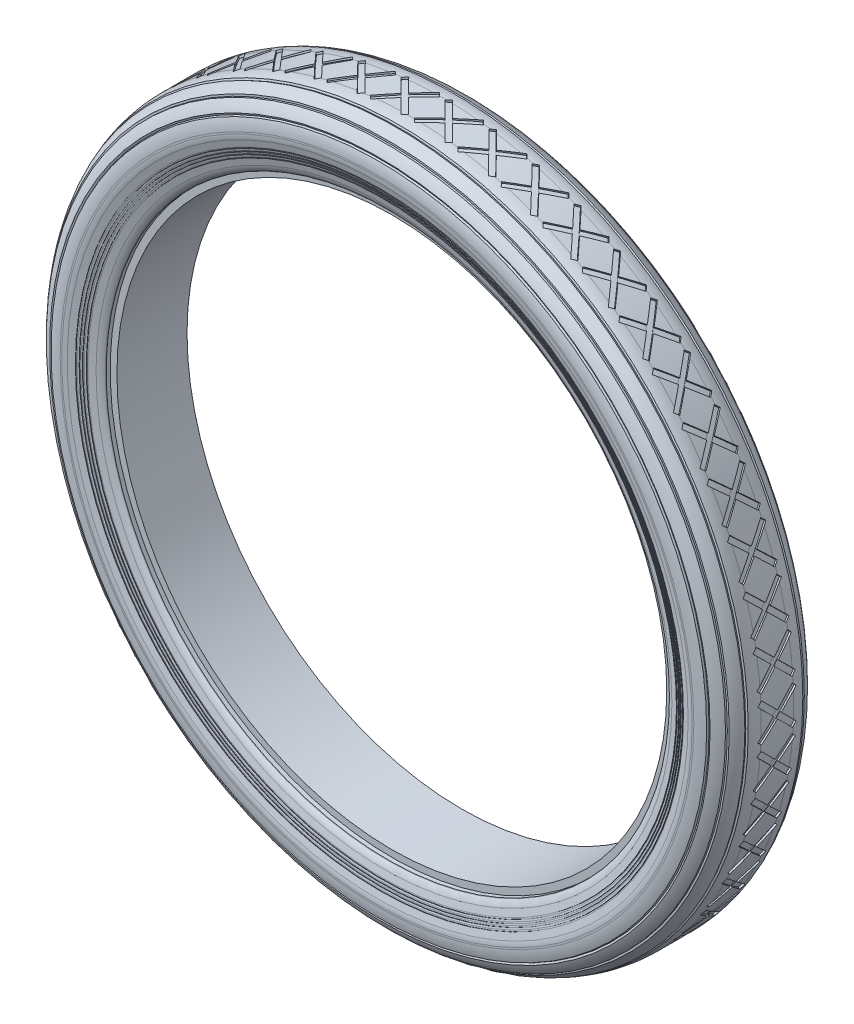
from build123d import *

# Parameters (mm, degrees)
CUT_REVOLVE_2_ANGLE      = 8
CUT_REVOLVE_3_ANGLE      = 8
PATTERN_CIRCULAR_6_COUNT = 50


with BuildPart() as part:
    # Эскиз2 → Повернуть1 (revolve)
    with BuildSketch(Plane(origin=(0, 0, 0), x_dir=(0, 0, -1), z_dir=(1, 0, 0))):
        with BuildLine():
            Line((-10.418793701, 260), (10.418793701, 260))
            Line((10.418793701, 260), (12, 260))
            ThreePointArc((12, 260), (16.178502184, 259.648328939), (20.239447704, 258.60320956))
            Line((20.239447704, 258.60320956), (20.792701047, 257.331332435))
            Line((20.792701047, 257.331332435), (22.064578172, 257.884585778))
            ThreePointArc((22.064578172, 257.884585778), (25.747933003, 255.880477441), (29.044507819, 253.288924332))
            Line((29.044507819, 253.288924332), (29.044507819, 251.90364999))
            Line((29.044507819, 251.90364999), (30.419191541, 251.90364999))
            ThreePointArc((30.419191541, 251.90364999), (32.959261901, 248.627521439), (34.92303721, 244.976691088))
            Line((34.92303721, 244.976691088), (34.364907479, 243.706946276))
            Line((34.364907479, 243.706946276), (35.634652291, 243.148816545))
            ThreePointArc((35.634652291, 243.148816545), (36.656300486, 239.131203985), (37, 235))
            Line((37, 235), (37, 233.788438789))
            ThreePointArc((37, 233.788438789), (36.878699379, 232.016687595), (36.517061185, 230.278000173))
            Line((36.517061185, 230.278000173), (35.193049841, 225.55701433))
            Line((35.193049841, 225.55701433), (34.711624411, 225.6920312))
            Line((34.711624411, 225.6920312), (34.441590671, 224.72918034))
            Line((34.441590671, 224.72918034), (34.923016101, 224.59416347))
            Line((34.923016101, 224.59416347), (34.577617008, 223.362584725))
            Line((34.577617008, 223.362584725), (34.096741575, 223.497447347))
            Line((34.096741575, 223.497447347), (33.826707835, 222.534596486))
            Line((33.826707835, 222.534596486), (34.307583268, 222.399733865))
            Line((34.307583268, 222.399733865), (34.037549528, 221.436883004))
            Line((34.037549528, 221.436883004), (33.556674096, 221.571745626))
            Line((33.556674096, 221.571745626), (33.286640356, 220.608894765))
            Line((33.286640356, 220.608894765), (33.767515788, 220.474032144))
            Line((33.767515788, 220.474032144), (33.422116695, 219.242453399))
            Line((33.422116695, 219.242453399), (32.940691265, 219.377470269))
            Line((32.940691265, 219.377470269), (32.670657525, 218.414619408))
            Line((32.670657525, 218.414619408), (33.152082955, 218.279602538))
            Line((33.152082955, 218.279602538), (31.828071611, 213.558616696))
            ThreePointArc((31.828071611, 213.558616696), (30.830599109, 211.20868521), (29.270630818, 209.187886281))
            Line((29.270630818, 209.187886281), (29, 208.917255463))
            Line((29, 208.917255463), (26, 208.917255463))
            Line((26, 208.917255463), (26, 203.917255463))
            Line((26, 203.917255463), (-26, 203.917255463))
            Line((-26, 203.917255463), (-26, 208.917255463))
            Line((-26, 208.917255463), (-29, 208.917255463))
            Line((-29, 208.917255463), (-29.270630818, 209.187886281))
            ThreePointArc((-29.270630818, 209.187886281), (-30.830599109, 211.20868521), (-31.828071611, 213.558616696))
            Line((-31.828071611, 213.558616696), (-33.152082955, 218.279602538))
            Line((-33.152082955, 218.279602538), (-32.670657525, 218.414619408))
            Line((-32.670657525, 218.414619408), (-32.940691265, 219.377470269))
            Line((-32.940691265, 219.377470269), (-33.422116695, 219.242453399))
            Line((-33.422116695, 219.242453399), (-33.767515788, 220.474032144))
            Line((-33.767515788, 220.474032144), (-33.286640356, 220.608894765))
            Line((-33.286640356, 220.608894765), (-33.556674096, 221.571745626))
            Line((-33.556674096, 221.571745626), (-34.037549528, 221.436883004))
            Line((-34.037549528, 221.436883004), (-34.307583268, 222.399733865))
            Line((-34.307583268, 222.399733865), (-33.826707835, 222.534596486))
            Line((-33.826707835, 222.534596486), (-34.096741575, 223.497447347))
            Line((-34.096741575, 223.497447347), (-34.577617008, 223.362584725))
            Line((-34.577617008, 223.362584725), (-34.923016101, 224.59416347))
            Line((-34.923016101, 224.59416347), (-34.441590671, 224.72918034))
            Line((-34.441590671, 224.72918034), (-34.711624411, 225.6920312))
            Line((-34.711624411, 225.6920312), (-35.193049841, 225.55701433))
            Line((-35.193049841, 225.55701433), (-36.517061185, 230.278000173))
            ThreePointArc((-36.517061185, 230.278000173), (-36.878699379, 232.016687595), (-37, 233.788438789))
            Line((-37, 233.788438789), (-37, 235))
            ThreePointArc((-37, 235), (-36.656300486, 239.131203985), (-35.634652291, 243.148816545))
            Line((-35.634652291, 243.148816545), (-34.364907479, 243.706946276))
            Line((-34.364907479, 243.706946276), (-34.92303721, 244.976691088))
            ThreePointArc((-34.92303721, 244.976691088), (-32.959261901, 248.627521439), (-30.419191541, 251.90364999))
            Line((-30.419191541, 251.90364999), (-29.044507819, 251.90364999))
            Line((-29.044507819, 251.90364999), (-29.044507819, 253.288924332))
            ThreePointArc((-29.044507819, 253.288924332), (-25.747933003, 255.880477441), (-22.064578172, 257.884585778))
            Line((-22.064578172, 257.884585778), (-20.792701047, 257.331332435))
            Line((-20.792701047, 257.331332435), (-20.239447704, 258.60320956))
            ThreePointArc((-20.239447704, 258.60320956), (-16.178502184, 259.648328939), (-12, 260))
            Line((-12, 260), (-10.418793701, 260))
        make_face()
    revolve(axis=Axis((0, 0, 70.330544058), (0, 0, -1)))

    # Эскиз5 → Вырез-Повернуть2 (revolve, symmetric, cut)
    with BuildSketch(Plane(origin=(0, 0, 0), x_dir=(1, 0, 0), z_dir=(0, -0.7071067811865475, 0.7071067811865477))) as cut_revolve_2_sk:
        Polygon((-260, 1.999999999), (-260.436919322, 1.999999999), (-260.436919322, -1.999999999), (-260, -1.999999999), (-259, -1.999999999), (-259, 1.999999999), align=None)
    cut_revolve_2 = revolve(axis=Axis((0, 37.220349627, 37.220349627), (0, -0.7071067811865477, -0.7071067811865475)), revolution_arc=CUT_REVOLVE_2_ANGLE / 2, mode=Mode.SUBTRACT)
    cut_revolve_2 = cut_revolve_2 + revolve(cut_revolve_2_sk.sketch, axis=Axis((0, 37.220349627, 37.220349627), (0, 0.7071067811865477, 0.7071067811865475)), revolution_arc=CUT_REVOLVE_2_ANGLE / 2, mode=Mode.SUBTRACT)

    # Эскиз6 → Вырез-Повернуть3 (revolve, symmetric, cut)
    with BuildSketch(Plane(origin=(0, 0, 0), x_dir=(1, 0, 0), z_dir=(0, 0.7071067811865475, 0.7071067811865477))) as cut_revolve_3_sk:
        Polygon((-259.872780333, 2), (-258.872780333, 2), (-258.872780333, -2), (-259.872780333, -2), (-260.577533075, -2), (-260.577533075, 2), align=None)
    cut_revolve_3 = revolve(axis=Axis((0, -23.13979632, 23.13979632), (0, 0.7071067811865477, -0.7071067811865475)), revolution_arc=CUT_REVOLVE_3_ANGLE / 2, mode=Mode.SUBTRACT)
    cut_revolve_3 = cut_revolve_3 + revolve(cut_revolve_3_sk.sketch, axis=Axis((0, -23.13979632, 23.13979632), (0, -0.7071067811865477, 0.7071067811865475)), revolution_arc=CUT_REVOLVE_3_ANGLE / 2, mode=Mode.SUBTRACT)

    # Круговой массив6: Вырез-Повернуть2, Вырез-Повернуть3 ×50 about axis
    pattern_circular_6_axis = Axis((0, 0, 70.330544058), (0, 0, 1))
    add([cut_revolve_2.rotate(pattern_circular_6_axis, i * 360 / PATTERN_CIRCULAR_6_COUNT) for i in range(1, PATTERN_CIRCULAR_6_COUNT)], mode=Mode.SUBTRACT)
    add([cut_revolve_3.rotate(pattern_circular_6_axis, i * 360 / PATTERN_CIRCULAR_6_COUNT) for i in range(1, PATTERN_CIRCULAR_6_COUNT)], mode=Mode.SUBTRACT)


solid = part.part
